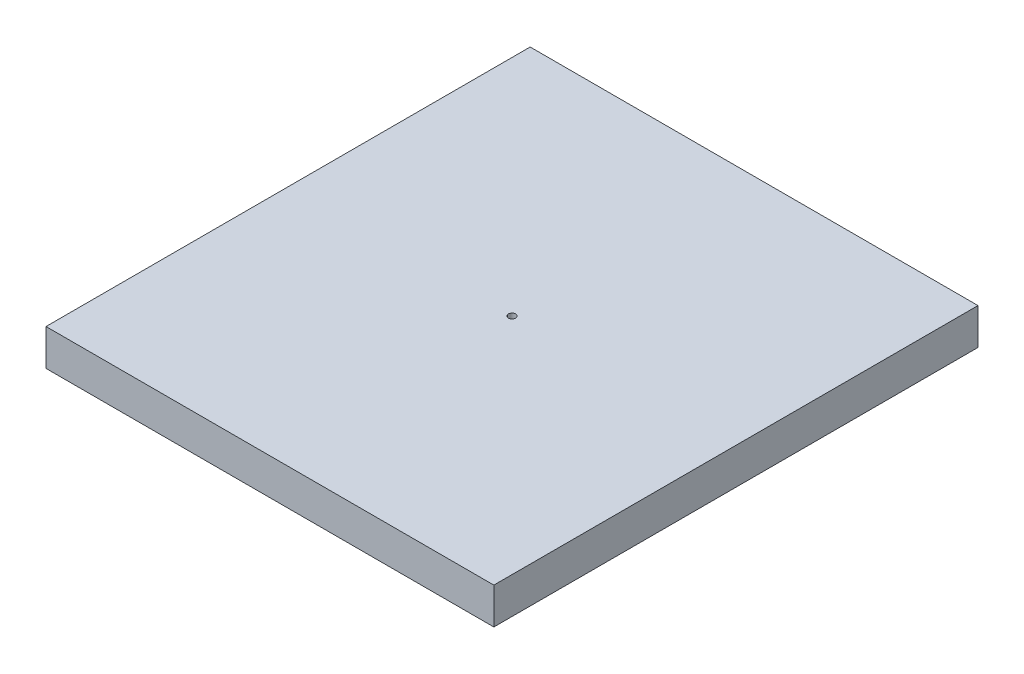
from build123d import *

# Parameters (mm, degrees)
SKETCH1_W           = 185
SKETCH1_H           = 200
BOSS_EXTRUDE1_DEPTH = 7.5
SKETCH2_R           = 1.5
CUT_EXTRUDE1_DEPTH  = 138.044700737


with BuildPart() as part:
    # Sketch1 → Boss-Extrude1 (new, symmetric)
    with BuildSketch(Plane(origin=(0, 0, 0), x_dir=(1, 0, 0), z_dir=(0, 1, 0))):
        Rectangle(SKETCH1_W, SKETCH1_H)
    extrude(amount=BOSS_EXTRUDE1_DEPTH, both=True)

    # Sketch2 → Cut-Extrude1 (cut, through all)
    with BuildSketch(Plane(origin=(0, 7.5, 0), x_dir=(1, 0, 0), z_dir=(0, 1, 0))):
        Circle(SKETCH2_R)
    extrude(amount=-CUT_EXTRUDE1_DEPTH, mode=Mode.SUBTRACT)


solid = part.part
